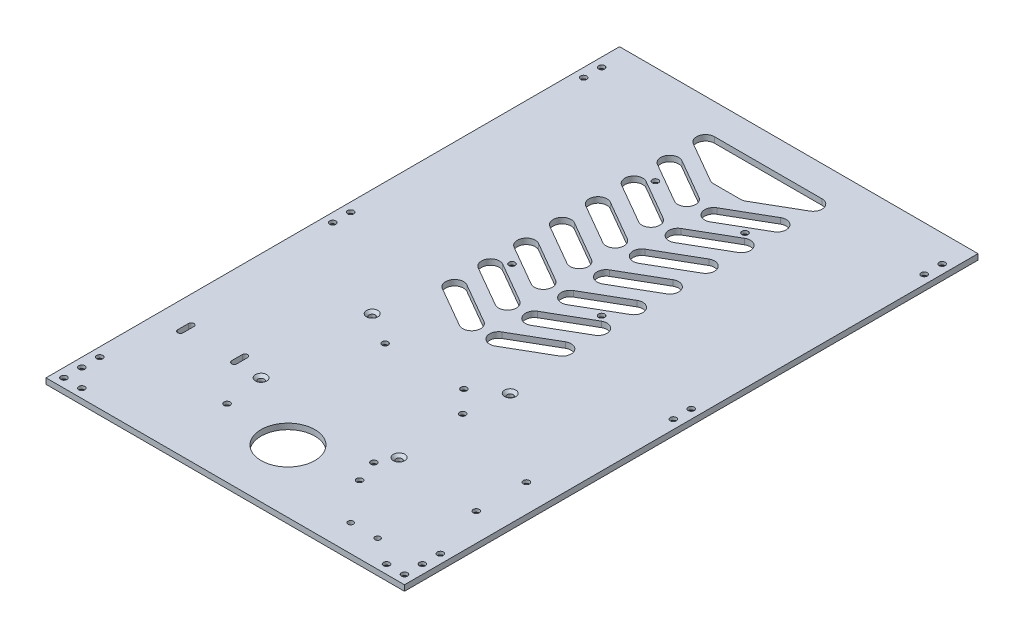
from build123d import *

# Parameters (mm, degrees)
SKETCH1_W                                       = 200
SKETCH1_H                                       = 320
BOSS_EXTRUDE1_DEPTH                             = 3.175
CSK_FOR_M3_FLAT_HEAD_MACHINE_SCREW1_D           = 3.4
CSK_FOR_M3_FLAT_HEAD_MACHINE_SCREW1_CSINK_D     = 6.3
CSK_FOR_M3_FLAT_HEAD_MACHINE_SCREW1_CSINK_ANGLE = 90
CSK_FOR_M3_FLAT_HEAD_MACHINE_SCREW2_D           = 3.4
CSK_FOR_M3_FLAT_HEAD_MACHINE_SCREW2_CSINK_D     = 6.3
CSK_FOR_M3_FLAT_HEAD_MACHINE_SCREW2_CSINK_ANGLE = 90
CSK_FOR_M3_FLAT_HEAD_MACHINE_SCREW3_D           = 3.4
CSK_FOR_M3_FLAT_HEAD_MACHINE_SCREW3_CSINK_D     = 6.3
CSK_FOR_M3_FLAT_HEAD_MACHINE_SCREW3_CSINK_ANGLE = 90
CUT_EXTRUDE1_DEPTH                              = 189.706334353
LPATTERN1_COUNT                                 = 8
LPATTERN1_PITCH                                 = 20
SKETCH9_R                                       = 15
SKETCH9_R_2                                     = 1.5
CUT_EXTRUDE2_DEPTH                              = 189.706334353
CSK_FOR_M3_FLAT_HEAD_MACHINE_SCREW4_D           = 3.4
CSK_FOR_M3_FLAT_HEAD_MACHINE_SCREW4_CSINK_D     = 6.3
CSK_FOR_M3_FLAT_HEAD_MACHINE_SCREW4_CSINK_ANGLE = 90
CSK_FOR_M3_FLAT_HEAD_MACHINE_SCREW5_D           = 3.4
CSK_FOR_M3_FLAT_HEAD_MACHINE_SCREW5_CSINK_D     = 6.3
CSK_FOR_M3_FLAT_HEAD_MACHINE_SCREW5_CSINK_ANGLE = 90


with BuildPart() as part:
    # Sketch1 → Boss-Extrude1 (new body)
    with BuildSketch(Plane(origin=(0, 0, 0), x_dir=(1, 0, 0), z_dir=(0, 1, 0))):
        Rectangle(SKETCH1_W, SKETCH1_H)
    extrude(amount=BOSS_EXTRUDE1_DEPTH)

    # CSK for M3 Flat Head Machine Screw1 (through all)
    with Locations(Plane.XZ):
        with Locations((-95, 155), (-85, 155), (-95, 145), (-95, 135), (-95, -145), (-95, -135), (-95, 5), (-95, -5)):
            csk_for_m3_flat_head_machine_screw1 = CounterSinkHole(CSK_FOR_M3_FLAT_HEAD_MACHINE_SCREW1_D / 2, CSK_FOR_M3_FLAT_HEAD_MACHINE_SCREW1_CSINK_D / 2, counter_sink_angle=CSK_FOR_M3_FLAT_HEAD_MACHINE_SCREW1_CSINK_ANGLE)

    # Mirror1: CSK for M3 Flat Head Machine Screw1 across plane
    add(csk_for_m3_flat_head_machine_screw1.mirror(Plane(origin=(0, 0, 0), x_dir=(0, 0, 1), z_dir=(1, 0, 0))), mode=Mode.SUBTRACT)

    # CSK for M3 Flat Head Machine Screw2 (through all)
    with Locations(Plane.XZ):
        with Locations((-25, -105), (25, -105), (25, -25), (-25, -25)):
            CounterSinkHole(CSK_FOR_M3_FLAT_HEAD_MACHINE_SCREW2_D / 2, CSK_FOR_M3_FLAT_HEAD_MACHINE_SCREW2_CSINK_D / 2, counter_sink_angle=CSK_FOR_M3_FLAT_HEAD_MACHINE_SCREW2_CSINK_ANGLE)

    # CSK for M3 Flat Head Machine Screw3 (through all)
    with Locations(Plane(origin=(0, 3.175, 0), x_dir=(-1, 0, 0), z_dir=(0, 1, 0))):
        with Locations((40, 38), (-37, 100), (-37, 38), (40, 100)):
            CounterSinkHole(CSK_FOR_M3_FLAT_HEAD_MACHINE_SCREW3_D / 2, CSK_FOR_M3_FLAT_HEAD_MACHINE_SCREW3_CSINK_D / 2, counter_sink_angle=CSK_FOR_M3_FLAT_HEAD_MACHINE_SCREW3_CSINK_ANGLE)

    # Sketch8 → Cut-Extrude1 (cut, through all)
    with BuildSketch(Plane(origin=(0, 3.175, 0), x_dir=(1, 0, 0), z_dir=(0, 1, 0))):
        with BuildLine():
            Line((-10, -19.330127019), (-32.5, -6.339745962))
            ThreePointArc((-32.5, -6.339745962), (-34.330127019, 0.490381057), (-27.5, 2.320508076))
            Line((-27.5, 2.320508076), (-5, -10.669872981))
            ThreePointArc((-5, -10.669872981), (-3.169872981, -17.5), (-10, -19.330127019))
        make_face()
        with BuildLine():
            Line((10, -19.330127019), (32.5, -6.339745962))
            ThreePointArc((32.5, -6.339745962), (34.330127019, 0.490381057), (27.5, 2.320508076))
            Line((27.5, 2.320508076), (5, -10.669872981))
            ThreePointArc((5, -10.669872981), (3.169872981, -17.5), (10, -19.330127019))
        make_face()
    cut_extrude1 = extrude(amount=-CUT_EXTRUDE1_DEPTH, mode=Mode.SUBTRACT)

    # LPattern1: Cut-Extrude1 ×8
    with Locations(*[(0, 0, -i * LPATTERN1_PITCH) for i in range(1, LPATTERN1_COUNT)]):
        add(cut_extrude1, mode=Mode.SUBTRACT)

    # Sketch9 → Cut-Extrude2 (cut, through all)
    with BuildSketch(Plane(origin=(0, 3.175, 0), x_dir=(1, 0, 0), z_dir=(0, 1, 0))):
        with Locations((0, -125)):
            Circle(SKETCH9_R)
        with Locations((55, -145)):
            Circle(SKETCH9_R_2)
        with Locations((70, -145)):
            Circle(SKETCH9_R_2)
        with BuildLine():
            Line((-7.5, 120), (7.5, 120))
            ThreePointArc((7.5, 120), (8.794095226, 120.170370869), (10, 120.669872981))
            Line((10, 120.669872981), (32.5, 133.660254038))
            ThreePointArc((32.5, 133.660254038), (34.829629131, 139.284476282), (30, 142.990381057))
            Line((30, 142.990381057), (-30, 142.990381057))
            ThreePointArc((-30, 142.990381057), (-34.829629131, 139.284476282), (-32.5, 133.660254038))
            Line((-32.5, 133.660254038), (-10, 120.669872981))
            ThreePointArc((-10, 120.669872981), (-8.794095226, 120.170370869), (-7.5, 120))
        make_face()
        with BuildLine():
            Line((-83.5, -94), (-83.5, -100))
            ThreePointArc((-83.5, -100), (-85, -101.5), (-86.5, -100))
            Line((-86.5, -100), (-86.5, -94))
            ThreePointArc((-86.5, -94), (-85, -92.5), (-83.5, -94))
        make_face()
        with BuildLine():
            Line((-56.5, -94), (-56.5, -100))
            ThreePointArc((-56.5, -100), (-55, -101.5), (-53.5, -100))
            Line((-53.5, -100), (-53.5, -94))
            ThreePointArc((-53.5, -94), (-55, -92.5), (-56.5, -94))
        make_face()
    extrude(amount=-CUT_EXTRUDE2_DEPTH, mode=Mode.SUBTRACT)

    # CSK for M3 Flat Head Machine Screw4 (through all)
    with Locations(Plane.XZ):
        with Locations((84.46, 104.38), (32.39, 109.46), (33.66, 61.2), (84.46, 76.44)):
            CounterSinkHole(CSK_FOR_M3_FLAT_HEAD_MACHINE_SCREW4_D / 2, CSK_FOR_M3_FLAT_HEAD_MACHINE_SCREW4_CSINK_D / 2, counter_sink_angle=CSK_FOR_M3_FLAT_HEAD_MACHINE_SCREW4_CSINK_ANGLE)

    # CSK for M3 Flat Head Machine Screw5 (through all)
    with Locations(Plane.XZ):
        with Locations((-37, 122), (37, 122), (22, 48.822134494), (-22, 48.822134494)):
            CounterSinkHole(CSK_FOR_M3_FLAT_HEAD_MACHINE_SCREW5_D / 2, CSK_FOR_M3_FLAT_HEAD_MACHINE_SCREW5_CSINK_D / 2, counter_sink_angle=CSK_FOR_M3_FLAT_HEAD_MACHINE_SCREW5_CSINK_ANGLE)


solid = part.part
